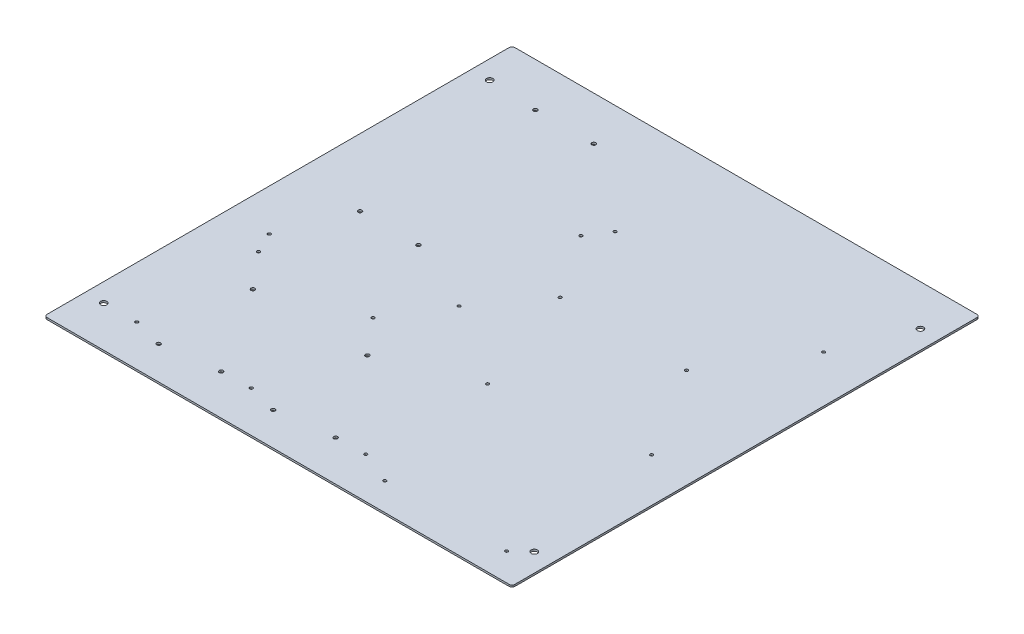
from build123d import *

# Parameters (mm, degrees)
SKETCH1_W           = 400.05
SKETCH1_H           = 400.05
BOSS_EXTRUDE1_DEPTH = 1.5875
CUT_EXTRUDE1_REACH  = 284.883
SKETCH2_R           = 2.665
FILLET1_R           = 2.54
CUT_EXTRUDE2_REACH  = 284.883
SKETCH3_R           = 1.665
CUT_EXTRUDE3_REACH  = 284.883
SKETCH4_R           = 1.665
CUT_EXTRUDE4_REACH  = 284.883
SKETCH5_R           = 1.27


with BuildPart() as part:
    # Sketch1 → Boss-Extrude1 (new body)
    with BuildSketch(Plane(origin=(0, 0, 0), x_dir=(1, 0, 0), z_dir=(0, 1, 0))):
        Rectangle(SKETCH1_W, SKETCH1_H)
    extrude(amount=BOSS_EXTRUDE1_DEPTH)

    # Sketch2 → Cut-Extrude1 (cut, up to next)
    with BuildSketch(Plane(origin=(0, 1.5875, 0), x_dir=(1, 0, 0), z_dir=(0, 1, 0)), mode=Mode.PRIVATE) as cut_extrude1_sk1:
        with Locations((-184.15, -165.1)):
            Circle(SKETCH2_R)
    cut_extrude1_tool1 = extrude(cut_extrude1_sk1.sketch, amount=-CUT_EXTRUDE1_REACH, mode=Mode.PRIVATE) & part.part
    # Sketch2 → Cut-Extrude1 (cut, up to next)
    with BuildSketch(Plane(origin=(0, 1.5875, 0), x_dir=(1, 0, 0), z_dir=(0, 1, 0)), mode=Mode.PRIVATE) as cut_extrude1_sk2:
        with Locations((184.15, -165.1)):
            Circle(SKETCH2_R)
    cut_extrude1_tool2 = extrude(cut_extrude1_sk2.sketch, amount=-CUT_EXTRUDE1_REACH, mode=Mode.PRIVATE) & part.part
    # Sketch2 → Cut-Extrude1 (cut, up to next)
    with BuildSketch(Plane(origin=(0, 1.5875, 0), x_dir=(1, 0, 0), z_dir=(0, 1, 0)), mode=Mode.PRIVATE) as cut_extrude1_sk3:
        with Locations((184.15, 165.1)):
            Circle(SKETCH2_R)
    cut_extrude1_tool3 = extrude(cut_extrude1_sk3.sketch, amount=-CUT_EXTRUDE1_REACH, mode=Mode.PRIVATE) & part.part
    # Sketch2 → Cut-Extrude1 (cut, up to next)
    with BuildSketch(Plane(origin=(0, 1.5875, 0), x_dir=(1, 0, 0), z_dir=(0, 1, 0)), mode=Mode.PRIVATE) as cut_extrude1_sk4:
        with Locations((-184.15, 165.1)):
            Circle(SKETCH2_R)
    cut_extrude1_tool4 = extrude(cut_extrude1_sk4.sketch, amount=-CUT_EXTRUDE1_REACH, mode=Mode.PRIVATE) & part.part
    add(cut_extrude1_tool1.solids().sort_by_distance((-184.15, 1.5875, 165.1))[0], mode=Mode.SUBTRACT)
    add(cut_extrude1_tool2.solids().sort_by_distance((184.15, 1.5875, 165.1))[0], mode=Mode.SUBTRACT)
    add(cut_extrude1_tool3.solids().sort_by_distance((184.15, 1.5875, -165.1))[0], mode=Mode.SUBTRACT)
    add(cut_extrude1_tool4.solids().sort_by_distance((-184.15, 1.5875, -165.1))[0], mode=Mode.SUBTRACT)

    # Fillet1
    fillet1_edges = [part.edges().sort_by_distance(p)[0] for p in [
        (-200.025, 0.79375, -200.025),
        (200.025, 0.79375, -200.025),
        (200.025, 0.79375, 200.025),
        (-200.025, 0.79375, 200.025),
    ]]
    fillet(fillet1_edges, radius=FILLET1_R)

    # Sketch3 → Cut-Extrude2 (cut, up to next)
    with BuildSketch(Plane.XZ, mode=Mode.PRIVATE) as cut_extrude2_sk1:
        with Locations((-130.439708106, 171.766169153)):
            Circle(SKETCH3_R)
    cut_extrude2_tool1 = extrude(cut_extrude2_sk1.sketch, amount=-CUT_EXTRUDE2_REACH, mode=Mode.PRIVATE) & part.part
    # Sketch3 → Cut-Extrude2 (cut, up to next)
    with BuildSketch(Plane.XZ, mode=Mode.PRIVATE) as cut_extrude2_sk2:
        with Locations((-83.186426808, 165.558058797)):
            Circle(SKETCH3_R)
    cut_extrude2_tool2 = extrude(cut_extrude2_sk2.sketch, amount=-CUT_EXTRUDE2_REACH, mode=Mode.PRIVATE) & part.part
    # Sketch3 → Cut-Extrude2 (cut, up to next)
    with BuildSketch(Plane.XZ, mode=Mode.PRIVATE) as cut_extrude2_sk3:
        with Locations((-130.567422903, 91.046045503)):
            Circle(SKETCH3_R)
    cut_extrude2_tool3 = extrude(cut_extrude2_sk3.sketch, amount=-CUT_EXTRUDE2_REACH, mode=Mode.PRIVATE) & part.part
    # Sketch3 → Cut-Extrude2 (cut, up to next)
    with BuildSketch(Plane.XZ, mode=Mode.PRIVATE) as cut_extrude2_sk4:
        with Locations((-32.50023816, 171.766169153)):
            Circle(SKETCH3_R)
    cut_extrude2_tool4 = extrude(cut_extrude2_sk4.sketch, amount=-CUT_EXTRUDE2_REACH, mode=Mode.PRIVATE) & part.part
    # Sketch3 → Cut-Extrude2 (cut, up to next)
    with BuildSketch(Plane.XZ, mode=Mode.PRIVATE) as cut_extrude2_sk5:
        with Locations((14.753043138, 165.558058797)):
            Circle(SKETCH3_R)
    cut_extrude2_tool5 = extrude(cut_extrude2_sk5.sketch, amount=-CUT_EXTRUDE2_REACH, mode=Mode.PRIVATE) & part.part
    # Sketch3 → Cut-Extrude2 (cut, up to next)
    with BuildSketch(Plane.XZ, mode=Mode.PRIVATE) as cut_extrude2_sk6:
        with Locations((-32.627952956, 91.046045503)):
            Circle(SKETCH3_R)
    cut_extrude2_tool6 = extrude(cut_extrude2_sk6.sketch, amount=-CUT_EXTRUDE2_REACH, mode=Mode.PRIVATE) & part.part
    add(cut_extrude2_tool1.solids().sort_by_distance((-130.439708, 0, 171.766169))[0], mode=Mode.SUBTRACT)
    add(cut_extrude2_tool2.solids().sort_by_distance((-83.186427, 0, 165.558059))[0], mode=Mode.SUBTRACT)
    add(cut_extrude2_tool3.solids().sort_by_distance((-130.567423, 0, 91.046046))[0], mode=Mode.SUBTRACT)
    add(cut_extrude2_tool4.solids().sort_by_distance((-32.500238, 0, 171.766169))[0], mode=Mode.SUBTRACT)
    add(cut_extrude2_tool5.solids().sort_by_distance((14.753043, 0, 165.558059))[0], mode=Mode.SUBTRACT)
    add(cut_extrude2_tool6.solids().sort_by_distance((-32.627953, 0, 91.046046))[0], mode=Mode.SUBTRACT)

    # Sketch4 → Cut-Extrude3 (cut, up to next)
    with BuildSketch(Plane(origin=(0, 1.5875, 0), x_dir=(1, 0, 0), z_dir=(0, 1, 0)), mode=Mode.PRIVATE) as cut_extrude3_sk1:
        with Locations((-142.525, 162.525)):
            Circle(SKETCH4_R)
    cut_extrude3_tool1 = extrude(cut_extrude3_sk1.sketch, amount=-CUT_EXTRUDE3_REACH, mode=Mode.PRIVATE) & part.part
    # Sketch4 → Cut-Extrude3 (cut, up to next)
    with BuildSketch(Plane(origin=(0, 1.5875, 0), x_dir=(1, 0, 0), z_dir=(0, 1, 0)), mode=Mode.PRIVATE) as cut_extrude3_sk2:
        with Locations((-92.525, 162.525)):
            Circle(SKETCH4_R)
    cut_extrude3_tool2 = extrude(cut_extrude3_sk2.sketch, amount=-CUT_EXTRUDE3_REACH, mode=Mode.PRIVATE) & part.part
    # Sketch4 → Cut-Extrude3 (cut, up to next)
    with BuildSketch(Plane(origin=(0, 1.5875, 0), x_dir=(1, 0, 0), z_dir=(0, 1, 0)), mode=Mode.PRIVATE) as cut_extrude3_sk3:
        with Locations((-92.525, 12.525)):
            Circle(SKETCH4_R)
    cut_extrude3_tool3 = extrude(cut_extrude3_sk3.sketch, amount=-CUT_EXTRUDE3_REACH, mode=Mode.PRIVATE) & part.part
    # Sketch4 → Cut-Extrude3 (cut, up to next)
    with BuildSketch(Plane(origin=(0, 1.5875, 0), x_dir=(1, 0, 0), z_dir=(0, 1, 0)), mode=Mode.PRIVATE) as cut_extrude3_sk4:
        with Locations((-142.525, 12.525)):
            Circle(SKETCH4_R)
    cut_extrude3_tool4 = extrude(cut_extrude3_sk4.sketch, amount=-CUT_EXTRUDE3_REACH, mode=Mode.PRIVATE) & part.part
    add(cut_extrude3_tool1.solids().sort_by_distance((-142.525, 1.5875, -162.525))[0], mode=Mode.SUBTRACT)
    add(cut_extrude3_tool2.solids().sort_by_distance((-92.525, 1.5875, -162.525))[0], mode=Mode.SUBTRACT)
    add(cut_extrude3_tool3.solids().sort_by_distance((-92.525, 1.5875, -12.525))[0], mode=Mode.SUBTRACT)
    add(cut_extrude3_tool4.solids().sort_by_distance((-142.525, 1.5875, -12.525))[0], mode=Mode.SUBTRACT)

    # Sketch5 → Cut-Extrude4 (cut, up to next)
    with BuildSketch(Plane(origin=(0, 1.5875, 0), x_dir=(1, 0, 0), z_dir=(0, 1, 0)), mode=Mode.PRIVATE) as cut_extrude4_sk1:
        with Locations((114.883029897, 34.336429963)):
            Circle(SKETCH5_R)
    cut_extrude4_tool1 = extrude(cut_extrude4_sk1.sketch, amount=-CUT_EXTRUDE4_REACH, mode=Mode.PRIVATE) & part.part
    # Sketch5 → Cut-Extrude4 (cut, up to next)
    with BuildSketch(Plane(origin=(0, 1.5875, 0), x_dir=(1, 0, 0), z_dir=(0, 1, 0)), mode=Mode.PRIVATE) as cut_extrude4_sk2:
        with Locations((160.02, 106.5284)):
            Circle(SKETCH5_R)
    cut_extrude4_tool2 = extrude(cut_extrude4_sk2.sketch, amount=-CUT_EXTRUDE4_REACH, mode=Mode.PRIVATE) & part.part
    # Sketch5 → Cut-Extrude4 (cut, up to next)
    with BuildSketch(Plane(origin=(0, 1.5875, 0), x_dir=(1, 0, 0), z_dir=(0, 1, 0)), mode=Mode.PRIVATE) as cut_extrude4_sk3:
        with Locations((-18.415, 106.5284)):
            Circle(SKETCH5_R)
    cut_extrude4_tool3 = extrude(cut_extrude4_sk3.sketch, amount=-CUT_EXTRUDE4_REACH, mode=Mode.PRIVATE) & part.part
    # Sketch5 → Cut-Extrude4 (cut, up to next)
    with BuildSketch(Plane(origin=(0, 1.5875, 0), x_dir=(1, 0, 0), z_dir=(0, 1, 0)), mode=Mode.PRIVATE) as cut_extrude4_sk4:
        with Locations((-29.9466, 88.85)):
            Circle(SKETCH5_R)
    cut_extrude4_tool4 = extrude(cut_extrude4_sk4.sketch, amount=-CUT_EXTRUDE4_REACH, mode=Mode.PRIVATE) & part.part
    # Sketch5 → Cut-Extrude4 (cut, up to next)
    with BuildSketch(Plane(origin=(0, 1.5875, 0), x_dir=(1, 0, 0), z_dir=(0, 1, 0)), mode=Mode.PRIVATE) as cut_extrude4_sk5:
        with Locations((-29.9466, -15.29)):
            Circle(SKETCH5_R)
    cut_extrude4_tool5 = extrude(cut_extrude4_sk5.sketch, amount=-CUT_EXTRUDE4_REACH, mode=Mode.PRIVATE) & part.part
    # Sketch5 → Cut-Extrude4 (cut, up to next)
    with BuildSketch(Plane(origin=(0, 1.5875, 0), x_dir=(1, 0, 0), z_dir=(0, 1, 0)), mode=Mode.PRIVATE) as cut_extrude4_sk6:
        with Locations((6.883029897, 34.336429963)):
            Circle(SKETCH5_R)
    cut_extrude4_tool6 = extrude(cut_extrude4_sk6.sketch, amount=-CUT_EXTRUDE4_REACH, mode=Mode.PRIVATE) & part.part
    # Sketch5 → Cut-Extrude4 (cut, up to next)
    with BuildSketch(Plane(origin=(0, 1.5875, 0), x_dir=(1, 0, 0), z_dir=(0, 1, 0)), mode=Mode.PRIVATE) as cut_extrude4_sk7:
        with Locations((-164.465, -43.1284)):
            Circle(SKETCH5_R)
    cut_extrude4_tool7 = extrude(cut_extrude4_sk7.sketch, amount=-CUT_EXTRUDE4_REACH, mode=Mode.PRIVATE) & part.part
    # Sketch5 → Cut-Extrude4 (cut, up to next)
    with BuildSketch(Plane(origin=(0, 1.5875, 0), x_dir=(1, 0, 0), z_dir=(0, 1, 0)), mode=Mode.PRIVATE) as cut_extrude4_sk8:
        with Locations((-155.9966, -60.8068)):
            Circle(SKETCH5_R)
    cut_extrude4_tool8 = extrude(cut_extrude4_sk8.sketch, amount=-CUT_EXTRUDE4_REACH, mode=Mode.PRIVATE) & part.part
    # Sketch5 → Cut-Extrude4 (cut, up to next)
    with BuildSketch(Plane(origin=(0, 1.5875, 0), x_dir=(1, 0, 0), z_dir=(0, 1, 0)), mode=Mode.PRIVATE) as cut_extrude4_sk9:
        with Locations((-155.9966, -164.9468)):
            Circle(SKETCH5_R)
    cut_extrude4_tool9 = extrude(cut_extrude4_sk9.sketch, amount=-CUT_EXTRUDE4_REACH, mode=Mode.PRIVATE) & part.part
    # Sketch5 → Cut-Extrude4 (cut, up to next)
    with BuildSketch(Plane(origin=(0, 1.5875, 0), x_dir=(1, 0, 0), z_dir=(0, 1, 0)), mode=Mode.PRIVATE) as cut_extrude4_sk10:
        with Locations((-58.057130054, -164.9468)):
            Circle(SKETCH5_R)
    cut_extrude4_tool10 = extrude(cut_extrude4_sk10.sketch, amount=-CUT_EXTRUDE4_REACH, mode=Mode.PRIVATE) & part.part
    # Sketch5 → Cut-Extrude4 (cut, up to next)
    with BuildSketch(Plane(origin=(0, 1.5875, 0), x_dir=(1, 0, 0), z_dir=(0, 1, 0)), mode=Mode.PRIVATE) as cut_extrude4_sk11:
        with Locations((39.882339893, -164.9468)):
            Circle(SKETCH5_R)
    cut_extrude4_tool11 = extrude(cut_extrude4_sk11.sketch, amount=-CUT_EXTRUDE4_REACH, mode=Mode.PRIVATE) & part.part
    # Sketch5 → Cut-Extrude4 (cut, up to next)
    with BuildSketch(Plane(origin=(0, 1.5875, 0), x_dir=(1, 0, 0), z_dir=(0, 1, 0)), mode=Mode.PRIVATE) as cut_extrude4_sk12:
        with Locations((67.720739893, -176.4784)):
            Circle(SKETCH5_R)
    cut_extrude4_tool12 = extrude(cut_extrude4_sk12.sketch, amount=-CUT_EXTRUDE4_REACH, mode=Mode.PRIVATE) & part.part
    # Sketch5 → Cut-Extrude4 (cut, up to next)
    with BuildSketch(Plane(origin=(0, 1.5875, 0), x_dir=(1, 0, 0), z_dir=(0, 1, 0)), mode=Mode.PRIVATE) as cut_extrude4_sk13:
        with Locations((171.860739893, -176.4784)):
            Circle(SKETCH5_R)
    cut_extrude4_tool13 = extrude(cut_extrude4_sk13.sketch, amount=-CUT_EXTRUDE4_REACH, mode=Mode.PRIVATE) & part.part
    # Sketch5 → Cut-Extrude4 (cut, up to next)
    with BuildSketch(Plane(origin=(0, 1.5875, 0), x_dir=(1, 0, 0), z_dir=(0, 1, 0)), mode=Mode.PRIVATE) as cut_extrude4_sk14:
        with Locations((39.882339893, -60.8068)):
            Circle(SKETCH5_R)
    cut_extrude4_tool14 = extrude(cut_extrude4_sk14.sketch, amount=-CUT_EXTRUDE4_REACH, mode=Mode.PRIVATE) & part.part
    # Sketch5 → Cut-Extrude4 (cut, up to next)
    with BuildSketch(Plane(origin=(0, 1.5875, 0), x_dir=(1, 0, 0), z_dir=(0, 1, 0)), mode=Mode.PRIVATE) as cut_extrude4_sk15:
        with Locations((-58.057130054, -60.8068)):
            Circle(SKETCH5_R)
    cut_extrude4_tool15 = extrude(cut_extrude4_sk15.sketch, amount=-CUT_EXTRUDE4_REACH, mode=Mode.PRIVATE) & part.part
    # Sketch5 → Cut-Extrude4 (cut, up to next)
    with BuildSketch(Plane(origin=(0, 1.5875, 0), x_dir=(1, 0, 0), z_dir=(0, 1, 0)), mode=Mode.PRIVATE) as cut_extrude4_sk16:
        with Locations((162.56, -43.1284)):
            Circle(SKETCH5_R)
    cut_extrude4_tool16 = extrude(cut_extrude4_sk16.sketch, amount=-CUT_EXTRUDE4_REACH, mode=Mode.PRIVATE) & part.part
    add(cut_extrude4_tool1.solids().sort_by_distance((114.88303, 1.5875, -34.33643))[0], mode=Mode.SUBTRACT)
    add(cut_extrude4_tool2.solids().sort_by_distance((160.02, 1.5875, -106.5284))[0], mode=Mode.SUBTRACT)
    add(cut_extrude4_tool3.solids().sort_by_distance((-18.415, 1.5875, -106.5284))[0], mode=Mode.SUBTRACT)
    add(cut_extrude4_tool4.solids().sort_by_distance((-29.9466, 1.5875, -88.85))[0], mode=Mode.SUBTRACT)
    add(cut_extrude4_tool5.solids().sort_by_distance((-29.9466, 1.5875, 15.29))[0], mode=Mode.SUBTRACT)
    add(cut_extrude4_tool6.solids().sort_by_distance((6.88303, 1.5875, -34.33643))[0], mode=Mode.SUBTRACT)
    add(cut_extrude4_tool7.solids().sort_by_distance((-164.465, 1.5875, 43.1284))[0], mode=Mode.SUBTRACT)
    add(cut_extrude4_tool8.solids().sort_by_distance((-155.9966, 1.5875, 60.8068))[0], mode=Mode.SUBTRACT)
    add(cut_extrude4_tool9.solids().sort_by_distance((-155.9966, 1.5875, 164.9468))[0], mode=Mode.SUBTRACT)
    add(cut_extrude4_tool10.solids().sort_by_distance((-58.05713, 1.5875, 164.9468))[0], mode=Mode.SUBTRACT)
    add(cut_extrude4_tool11.solids().sort_by_distance((39.88234, 1.5875, 164.9468))[0], mode=Mode.SUBTRACT)
    add(cut_extrude4_tool12.solids().sort_by_distance((67.72074, 1.5875, 176.4784))[0], mode=Mode.SUBTRACT)
    add(cut_extrude4_tool13.solids().sort_by_distance((171.86074, 1.5875, 176.4784))[0], mode=Mode.SUBTRACT)
    add(cut_extrude4_tool14.solids().sort_by_distance((39.88234, 1.5875, 60.8068))[0], mode=Mode.SUBTRACT)
    add(cut_extrude4_tool15.solids().sort_by_distance((-58.05713, 1.5875, 60.8068))[0], mode=Mode.SUBTRACT)
    add(cut_extrude4_tool16.solids().sort_by_distance((162.56, 1.5875, 43.1284))[0], mode=Mode.SUBTRACT)


solid = part.part
